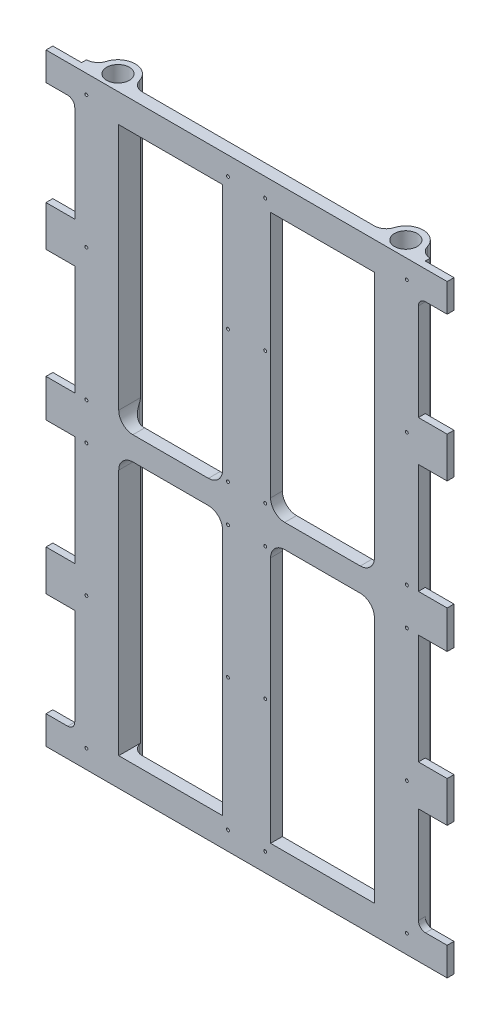
from build123d import *

# Parameters (mm, degrees)
SKETCH1_R                    = 4.825
BOSS_EXTRUDE1_DEPTH          = 255.6
CUT_EXTRUDE2_DEPTH           = 270.507403655
CUT_EXTRUDE2_DEPTH_BACK      = 270.507403655
SKETCH2_W                    = 15
SKETCH2_H                    = 46.6
F_1_25_1_25_DIAMETER_HOLE1_D = 1.25
SKETCH5_R                    = 1.5
SKETCH5_W                    = 15.840384185
SKETCH5_H                    = 255.6
CUT_EXTRUDE3_DEPTH           = 270.507403753
SKETCH6_W                    = 15.782401894
SKETCH6_H                    = 255.6
CUT_EXTRUDE4_DEPTH           = 2.1


with BuildPart() as part:
    # Sketch1 → Boss-Extrude1 (new body)
    with BuildSketch(Plane(origin=(0, 0, 0), x_dir=(1, 0, 0), z_dir=(0, 1, 0))):
        with BuildLine():
            Line((85, -5), (85, 0))
            Line((85, 0), (72.817598106, 0))
            ThreePointArc((72.817598106, 0), (69.825892195, 0.993792849), (68.023440659, 3.580121704))
            ThreePointArc((68.023440659, 3.580121704), (61, 8.825), (53.976559341, 3.580121704))
            ThreePointArc((53.976559341, 3.580121704), (52.174107805, 0.993792849), (49.182401894, 0))
            Line((49.182401894, 0), (-49.182401894, 0))
            ThreePointArc((-49.182401894, 0), (-52.174107805, 0.993792849), (-53.976559341, 3.580121704))
            ThreePointArc((-53.976559341, 3.580121704), (-61, 8.825), (-68.023440659, 3.580121704))
            ThreePointArc((-68.023440659, 3.580121704), (-69.825892195, 0.993792849), (-72.817598106, 0))
            Line((-72.817598106, 0), (-85, 0))
            Line((-85, 0), (-85, -5))
            Line((-85, -5), (85, -5))
        make_face()
        with Locations((-61, 1.5)):
            Circle(SKETCH1_R, mode=Mode.SUBTRACT)
        with Locations((61, 1.5)):
            Circle(SKETCH1_R, mode=Mode.SUBTRACT)
    extrude(amount=BOSS_EXTRUDE1_DEPTH)

    # Sketch2 → Cut-Extrude2 (cut, two sides: drawn at the far end of the back side and taken through both)
    with BuildSketch(Plane(origin=(0, 0, 0), x_dir=(-1, 0, 0), z_dir=(0, 0, -1)).offset(-CUT_EXTRUDE2_DEPTH_BACK)):
        with BuildLine():
            Line((-54.175, 243.6), (-10.175, 243.6))
            Line((-10.175, 243.6), (-10.175, 138.8))
            ThreePointArc((-10.175, 138.8), (-11.932359313, 134.557359313), (-16.175, 132.8))
            Line((-16.175, 132.8), (-48.175, 132.8))
            ThreePointArc((-48.175, 132.8), (-52.417640687, 134.557359313), (-54.175, 138.8))
            Line((-54.175, 138.8), (-54.175, 243.6))
        make_face()
        with BuildLine():
            Line((-87.817598106, 199.6), (-72.817598106, 199.6))
            Line((-72.817598106, 199.6), (-72.817598106, 240.6))
            ThreePointArc((-72.817598106, 240.6), (-73.696277763, 242.721320344), (-75.817598106, 243.6))
            Line((-75.817598106, 243.6), (-87.817598106, 243.6))
            Line((-87.817598106, 243.6), (-87.817598106, 199.6))
        make_face()
        with BuildLine():
            Line((-10.175, 12), (-10.175, 116.8))
            ThreePointArc((-10.175, 116.8), (-11.932359313, 121.042640687), (-16.175, 122.8))
            Line((-16.175, 122.8), (-48.175, 122.8))
            ThreePointArc((-48.175, 122.8), (-52.417640687, 121.042640687), (-54.175, 116.8))
            Line((-54.175, 116.8), (-54.175, 12))
            Line((-54.175, 12), (-10.175, 12))
        make_face()
        with BuildLine():
            Line((54.175, 12), (10.175, 12))
            Line((10.175, 12), (10.175, 116.8))
            ThreePointArc((10.175, 116.8), (11.932359313, 121.042640687), (16.175, 122.8))
            Line((16.175, 122.8), (48.175, 122.8))
            ThreePointArc((48.175, 122.8), (52.417640687, 121.042640687), (54.175, 116.8))
            Line((54.175, 116.8), (54.175, 12))
        make_face()
        with BuildLine():
            Line((10.175, 243.6), (10.175, 138.8))
            ThreePointArc((10.175, 138.8), (11.932359313, 134.557359313), (16.175, 132.8))
            Line((16.175, 132.8), (48.175, 132.8))
            ThreePointArc((48.175, 132.8), (52.417640687, 134.557359313), (54.175, 138.8))
            Line((54.175, 138.8), (54.175, 243.6))
            Line((54.175, 243.6), (10.175, 243.6))
        make_face()
        with Locations((-80.317598106, 159.1)):
            Rectangle(SKETCH2_W, SKETCH2_H)
        with Locations((-80.317598106, 96.5)):
            Rectangle(SKETCH2_W, SKETCH2_H)
        with BuildLine():
            Line((-72.817598106, 56), (-72.817598106, 15))
            ThreePointArc((-72.817598106, 15), (-73.696277763, 12.878679656), (-75.817598106, 12))
            Line((-75.817598106, 12), (-87.817598106, 12))
            Line((-87.817598106, 12), (-87.817598106, 56))
            Line((-87.817598106, 56), (-72.817598106, 56))
        make_face()
        with BuildLine():
            Line((87.817598106, 56), (72.817598106, 56))
            Line((72.817598106, 56), (72.817598106, 15))
            ThreePointArc((72.817598106, 15), (73.696277763, 12.878679656), (75.817598106, 12))
            Line((75.817598106, 12), (87.817598106, 12))
            Line((87.817598106, 12), (87.817598106, 56))
        make_face()
        with Locations((80.317598106, 96.5)):
            Rectangle(SKETCH2_W, SKETCH2_H)
        with Locations((80.317598106, 159.1)):
            Rectangle(SKETCH2_W, SKETCH2_H)
        with BuildLine():
            Line((72.817598106, 199.6), (72.817598106, 240.6))
            ThreePointArc((72.817598106, 240.6), (73.696277763, 242.721320344), (75.817598106, 243.6))
            Line((75.817598106, 243.6), (87.817598106, 243.6))
            Line((87.817598106, 243.6), (87.817598106, 199.6))
            Line((87.817598106, 199.6), (72.817598106, 199.6))
        make_face()
    extrude(amount=CUT_EXTRUDE2_DEPTH + CUT_EXTRUDE2_DEPTH_BACK, mode=Mode.SUBTRACT)

    # Ø1.25 (1.25) Diameter Hole1 (through all)
    with Locations(Plane(origin=(0, 0, 5), x_dir=(-1, 0, 0), z_dir=(0, 0, 1))):
        with Locations((-67.9, -7.9), (-7.9, -7.9), (-7.9, -63.9), (-67.9, -63.9), (-67.9, -119.9), (-7.9, -119.9), (7.9, -119.9), (67.9, -119.9), (67.9, -63.9), (7.9, -63.9), (7.9, -7.9), (67.9, -7.9), (67.9, -503.3), (7.9, -503.3), (7.9, -447.3), (67.9, -447.3), (67.9, -391.3), (7.9, -391.3), (-7.9, -391.3), (-67.9, -391.3), (-67.9, -447.3), (-7.9, -447.3), (-7.9, -503.3), (-67.9, -503.3), (67.9, -247.7), (7.9, -247.7), (7.9, -191.7), (67.9, -191.7), (67.9, -135.7), (7.9, -135.7), (-7.9, -135.7), (-67.9, -135.7), (-67.9, -191.7), (-7.9, -191.7), (-7.9, -247.7), (-67.9, -247.7)):
            Hole(F_1_25_1_25_DIAMETER_HOLE1_D / 2)

    # Sketch5 → Cut-Extrude3 (cut, through all)
    with BuildSketch(Plane(origin=(0, 0, 0), x_dir=(-1, 0, 0), z_dir=(0, 0, -1))):
        with Locations((-67.9, 247.7)):
            Circle(SKETCH5_R)
        with Locations((-7.9, 247.7)):
            Circle(SKETCH5_R)
        with Locations((-67.9, 191.7)):
            Circle(SKETCH5_R)
        with Locations((-67.9, 135.7)):
            Circle(SKETCH5_R)
        with Locations((-7.9, 135.7)):
            Circle(SKETCH5_R)
        with Locations((-7.9, 191.7)):
            Circle(SKETCH5_R)
        with Locations((7.9, 191.7)):
            Circle(SKETCH5_R)
        with Locations((7.9, 135.7)):
            Circle(SKETCH5_R)
        with Locations((67.9, 135.7)):
            Circle(SKETCH5_R)
        with Locations((67.9, 191.7)):
            Circle(SKETCH5_R)
        with Locations((7.9, 247.7)):
            Circle(SKETCH5_R)
        with Locations((67.9, 247.7)):
            Circle(SKETCH5_R)
        with Locations((67.9, 7.9)):
            Circle(SKETCH5_R)
        with Locations((7.9, 7.9)):
            Circle(SKETCH5_R)
        with Locations((67.9, 63.9)):
            Circle(SKETCH5_R)
        with Locations((67.9, 119.9)):
            Circle(SKETCH5_R)
        with Locations((7.9, 119.9)):
            Circle(SKETCH5_R)
        with Locations((7.9, 63.9)):
            Circle(SKETCH5_R)
        with Locations((-7.9, 63.9)):
            Circle(SKETCH5_R)
        with Locations((-7.9, 119.9)):
            Circle(SKETCH5_R)
        with Locations((-67.9, 119.9)):
            Circle(SKETCH5_R)
        with Locations((-67.9, 63.9)):
            Circle(SKETCH5_R)
        with Locations((-7.9, 7.9)):
            Circle(SKETCH5_R)
        with Locations((-67.9, 7.9)):
            Circle(SKETCH5_R)
        with Locations((-80.737790199, 127.8)):
            Rectangle(SKETCH5_W, SKETCH5_H)
        with Locations((80.737790199, 127.8)):
            Rectangle(SKETCH5_W, SKETCH5_H)
    extrude(amount=CUT_EXTRUDE3_DEPTH, mode=Mode.SUBTRACT)

    # Sketch6 → Cut-Extrude4 (cut)
    with BuildSketch(Plane(origin=(0, 0, 0), x_dir=(-1, 0, 0), z_dir=(0, 0, -1))):
        with Locations((80.708799053, 127.8)):
            Rectangle(SKETCH6_W, SKETCH6_H)
        with Locations((-80.708799053, 127.8)):
            Rectangle(SKETCH6_W, SKETCH6_H)
    extrude(amount=-CUT_EXTRUDE4_DEPTH, mode=Mode.SUBTRACT)


solid = part.part
